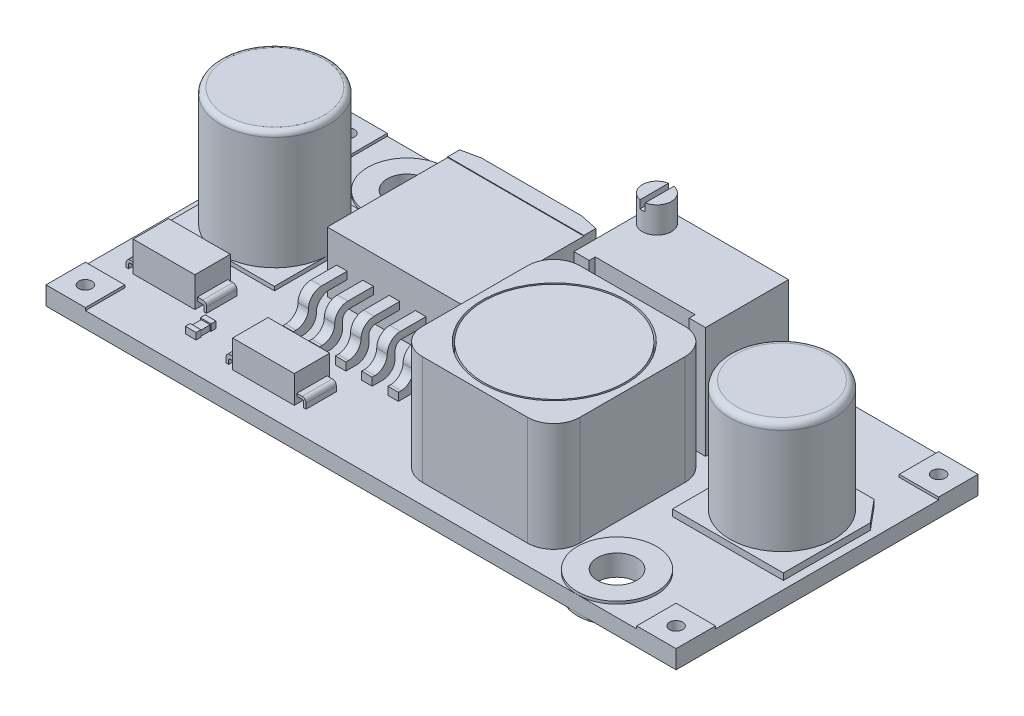
from build123d import *

# Parameters (mm, degrees)
SKETCH1_W                 = 48
SKETCH1_H                 = 23
BOSS_EXTRUDE1_DEPTH       = 1.2
SKETCH2_W                 = 3
SKETCH2_H                 = 3
BOSS_EXTRUDE2_DEPTH       = 0.2
SKETCH3_R                 = 0.5
CUT_EXTRUDE1_DEPTH        = 2
BOSS_EXTRUDE4_DEPTH       = 0.2
BOSS_EXTRUDE4_DEPTH_BACK  = 1.4
SKETCH6_R                 = 3
SKETCH9_R                 = 1.5
CUT_EXTRUDE2_DEPTH        = 2.2
BOSS_EXTRUDE6_DEPTH       = 0.2
BOSS_EXTRUDE6_DEPTH_BACK  = 1.4
SKETCH10_R                = 3
SKETCH12_R                = 1.5
CUT_EXTRUDE4_DEPTH        = 2.2
BOSS_EXTRUDE7_DEPTH       = 1.5
SKETCH14_R                = 4.114223408
BOSS_EXTRUDE8_DEPTH       = 9
FILLET3_R                 = 0.4
SKETCH15_W                = 0.8
SKETCH15_H                = 0.996026271
BOSS_EXTRUDE10_DEPTH      = 0.1
BOSS_EXTRUDE11_DEPTH      = 1.3
SKETCH17_W                = 4.7
SKETCH17_H                = 2.7
BOSS_EXTRUDE12_DEPTH      = 3.5
SKETCH19_W                = 2.321344566
SKETCH19_H                = 0.634066474
BOSS_EXTRUDE14_DEPTH      = 0.7
FILLET4_R                 = 0.3
SKETCH22_W                = 0.50832048
SKETCH22_H                = 0.425111189
CUT_EXTRUDE5_DEPTH        = 2.7
FILLET7_R                 = 0.1
SKETCH23_W                = 2.3
SKETCH23_H                = 0.729977936
BOSS_EXTRUDE15_DEPTH      = 0.7
FILLET8_R                 = 0.3
SKETCH30_W                = 0.503123542
SKETCH30_H                = 0.447939362
CUT_EXTRUDE6_DEPTH        = 2.7
FILLET9_R                 = 0.1
SKETCH31_W                = 11
SKETCH31_H                = 10
BOSS_EXTRUDE16_DEPTH      = 0.1
SKETCH32_W                = 10.374986353
SKETCH32_H                = 9.166939997
BOSS_EXTRUDE17_DEPTH      = 4.6
SKETCH33_W                = 0.8
SKETCH33_H                = 2.544252459
BOSS_EXTRUDE19_DEPTH      = 4.1
SKETCH37_W                = 2.34763847
SKETCH37_H                = 1.983330998
CUT_EXTRUDE10_DEPTH       = 10.1
SKETCH38_W                = 1.15236153
SKETCH38_H                = 1.944252459
CUT_EXTRUDE11_DEPTH       = 10.1
FILLET15_R                = 1
FILLET16_R                = 1
FILLET17_START            = -7.984544591
FILLET17_DEPTH            = 0.8
CUT_EXTRUDE12_DEPTH       = 10.1
FILLET18_R                = 1
FILLET19_R                = 1
FILLET20_R                = 1
FILLET21_R                = 1
FILLET23_R                = 0.5
FILLET24_R                = 0.5
FILLET25_R                = 0.5
FILLET26_R                = 0.5
FILLET28_START            = -5.984544591
FILLET28_DEPTH            = 0.8
FILLET29_START            = -3.984544591
FILLET29_DEPTH            = 0.8
FILLET30_START            = -1.984544591
FILLET30_DEPTH            = 0.8
FILLET31_START            = 0.015455409
FILLET31_DEPTH            = 0.8
SKETCH41_W                = 4.7
SKETCH41_H                = 2.7
BOSS_EXTRUDE20_DEPTH      = 2.1
BOSS_EXTRUDE21_DEPTH      = 0.7
BOSS_EXTRUDE21_DEPTH_BACK = 5.4
SKETCH44_W                = 2.3
SKETCH44_H                = 0.7
SKETCH48_W                = 0.482952196
SKETCH48_H                = 0.4
CUT_EXTRUDE13_DEPTH       = 2.7
SKETCH50_W                = 0.5
SKETCH50_H                = 0.5
CUT_EXTRUDE14_DEPTH       = 2.7
FILLET33_R                = 0.3
FILLET34_R                = 0.1
FILLET35_R                = 0.3
FILLET36_R                = 0.1
BOSS_EXTRUDE22_DEPTH      = 4.65
SKETCH52_W                = 12
SKETCH52_H                = 12
BOSS_EXTRUDE23_DEPTH      = 9.5
SKETCH53_R                = 5.5
CUT_EXTRUDE15_DEPTH       = 8.5
SKETCH54_R                = 5.373077755
BOSS_EXTRUDE24_DEPTH      = 8.5
FILLET38_R                = 2
FILLET39_R                = 2
FILLET40_R                = 2
FILLET41_R                = 2
BOSS_EXTRUDE25_DEPTH      = 8.5
SKETCH56_R                = 1.108072724
BOSS_EXTRUDE26_DEPTH      = 2
CUT_EXTRUDE18_DEPTH       = 0.6
BOSS_EXTRUDE27_DEPTH      = 0.5
SKETCH60_R                = 3.971206554
BOSS_EXTRUDE28_DEPTH      = 8.5
FILLET42_R                = 0.5
SKETCH61_W                = 0.812548187
SKETCH61_H                = 0.377254516
SKETCH61_W_2              = 0.678235166
SKETCH61_H_2              = 0.768684228
BOSS_EXTRUDE30_DEPTH      = 0.5
SKETCH62_W                = 0.678235166
SKETCH62_H                = 0.768684228
CUT_EXTRUDE19_DEPTH       = 0.1
SKETCH63_W                = 0.4
SKETCH63_H                = 0.768429278
SKETCH63_W_2              = 0.756649139
SKETCH63_H_2              = 0.669042342
BOSS_EXTRUDE31_DEPTH      = 0.5
SKETCH64_W                = 0.756649139
SKETCH64_H                = 0.669042342
CUT_EXTRUDE20_DEPTH       = 0.1
SKETCH66_W                = 0.386927708
SKETCH66_H                = 0.773855416
SKETCH66_W_2              = 0.813972447
SKETCH66_H_2              = 0.673855416
BOSS_EXTRUDE32_DEPTH      = 0.5
SKETCH67_W                = 0.813972447
SKETCH67_H                = 0.673855416
CUT_EXTRUDE21_DEPTH       = 0.1


with BuildPart() as part:
    # Sketch1 → Boss-Extrude1 (new body)
    with BuildSketch(Plane(origin=(0, 0, 0), x_dir=(1, 0, 0), z_dir=(0, 1, 0))):
        with Locations((3.904076739, -3.778177458)):
            Rectangle(SKETCH1_W, SKETCH1_H)
    extrude(amount=BOSS_EXTRUDE1_DEPTH)

    # Sketch2 → Boss-Extrude2 (add)
    with BuildSketch(Plane(origin=(0, 1.2, 0), x_dir=(1, 0, 0), z_dir=(0, 1, 0))):
        with Locations((26.404076739, 6.221822542)):
            Rectangle(SKETCH2_W, SKETCH2_H)
        with Locations((-18.595923261, 6.221822542)):
            Rectangle(SKETCH2_W, SKETCH2_H)
        with Locations((26.404076739, -13.778177458)):
            Rectangle(SKETCH2_W, SKETCH2_H)
        with Locations((-18.595923261, -13.778177458)):
            Rectangle(SKETCH2_W, SKETCH2_H)
    extrude(amount=BOSS_EXTRUDE2_DEPTH)

    # Sketch3 → Cut-Extrude1 (cut)
    with BuildSketch(Plane(origin=(0, 1.4, 0), x_dir=(1, 0, 0), z_dir=(0, 1, 0))):
        with Locations(Location((-18.595923261, 6.221822542, 0), (0, 0, 270))):
            Circle(SKETCH3_R)
        with Locations(Location((26.404076739, 6.221822542, 0), (0, 0, 270))):
            Circle(SKETCH3_R)
        with Locations(Location((26.404076739, -13.778177458, 0), (0, 0, 270))):
            Circle(SKETCH3_R)
        with Locations(Location((-18.595923261, -13.778177458, 0), (0, 0, 270))):
            Circle(SKETCH3_R)
    extrude(amount=-CUT_EXTRUDE1_DEPTH, mode=Mode.SUBTRACT)

    # Sketch6 → Boss-Extrude4 (add, two sides: drawn at the far end of the back side and taken through both)
    with BuildSketch(Plane(origin=(0, 1.2, 0), x_dir=(1, 0, 0), z_dir=(0, 1, 0)).offset(-BOSS_EXTRUDE4_DEPTH_BACK)):
        with Locations(Location((-12.595923261, 4.721822542, 0), (0, 0, 270))):
            Circle(SKETCH6_R)
    extrude(amount=BOSS_EXTRUDE4_DEPTH + BOSS_EXTRUDE4_DEPTH_BACK)

    # Sketch9 → Cut-Extrude2 (cut)
    with BuildSketch(Plane(origin=(0, 1.4, 0), x_dir=(1, 0, 0), z_dir=(0, 1, 0))):
        with Locations(Location((-12.595923261, 4.721822542, 0), (0, 0, 270))):
            Circle(SKETCH9_R)
    extrude(amount=-CUT_EXTRUDE2_DEPTH, mode=Mode.SUBTRACT)

    # Sketch10 → Boss-Extrude6 (add, two sides: drawn at the far end of the back side and taken through both)
    with BuildSketch(Plane(origin=(0, 1.2, 0), x_dir=(1, 0, 0), z_dir=(0, 1, 0)).offset(-BOSS_EXTRUDE6_DEPTH_BACK)):
        with Locations(Location((20.404076739, -12.278177458, 0), (0, 0, 270))):
            Circle(SKETCH10_R)
    extrude(amount=BOSS_EXTRUDE6_DEPTH + BOSS_EXTRUDE6_DEPTH_BACK)

    # Sketch12 → Cut-Extrude4 (cut)
    with BuildSketch(Plane(origin=(0, 1.4, 0), x_dir=(1, 0, 0), z_dir=(0, 1, 0))):
        with Locations(Location((20.404076739, -12.278177458, 0), (0, 0, 270))):
            Circle(SKETCH12_R)
    extrude(amount=-CUT_EXTRUDE4_DEPTH, mode=Mode.SUBTRACT)

    # Sketch13 → Boss-Extrude7 (add)
    with BuildSketch(Plane(origin=(0, 0, 0), x_dir=(1, 0, 0), z_dir=(0, 1, 0))):
        Polygon((-18.219111741, 1.521822542), (-12.401181598, 1.521822542), (-11.195923261, -0.318653576), (-11.195923261, -6.778177458), (-19.495923261, -6.778177458), (-19.495923261, -0.318653576), align=None)
    extrude(amount=BOSS_EXTRUDE7_DEPTH)

    # Sketch14 → Boss-Extrude8 (add)
    with BuildSketch(Plane(origin=(0, 1.5, 0), x_dir=(1, 0, 0), z_dir=(0, 1, 0))):
        with Locations((-15.31014667, -2.628177458)):
            Circle(SKETCH14_R)
    extrude(amount=BOSS_EXTRUDE8_DEPTH)

    # Fillet3
    fillet3_edges = [part.edges().sort_by_distance(p)[0] for p in [
        (-19.424370078, 10.5, 2.628177458),
    ]]
    fillet(fillet3_edges, radius=FILLET3_R)

    # Sketch15 → Boss-Extrude10 (add)
    with BuildSketch(Plane(origin=(0, 1.2, 0), x_dir=(1, 0, 0), z_dir=(0, 1, 0))):
        with Locations((-15.544774873, 2.019835678)):
            Rectangle(SKETCH15_W, SKETCH15_H)
    extrude(amount=BOSS_EXTRUDE10_DEPTH)

    # Sketch16 → Boss-Extrude11 (add)
    with BuildSketch(Plane(origin=(0, 0, 0), x_dir=(1, 0, 0), z_dir=(0, 1, 0))):
        Polygon((-15.944774873, -6.778177458), (-15.944774873, -7.863228993), (-15.161070215, -7.863228993), (-15.159186231, -6.778177458), align=None)
    extrude(amount=BOSS_EXTRUDE11_DEPTH)

    # Sketch17 → Boss-Extrude12 (add)
    with BuildSketch(Plane(origin=(0, 0, 0), x_dir=(1, 0, 0), z_dir=(0, 1, 0))):
        with Locations((-15.344373349, -9.6906619)):
            Rectangle(SKETCH17_W, SKETCH17_H)
    extrude(amount=BOSS_EXTRUDE12_DEPTH)

    # Sketch19 → Boss-Extrude14 (add)
    with BuildSketch(Plane.ZY.offset(17.694373349)):
        with Locations((9.712086064, 1.517033237)):
            Rectangle(SKETCH19_W, SKETCH19_H)
    extrude(amount=BOSS_EXTRUDE14_DEPTH)

    # Fillet4
    fillet4_edges = [part.edges().sort_by_distance(p)[0] for p in [
        (-18.394373349, 1.834066474, 9.712086064),
    ]]
    fillet(fillet4_edges, radius=FILLET4_R)

    # Sketch22 → Cut-Extrude5 (cut)
    with BuildSketch(Plane.XY.offset(10.872758347)):
        with Locations((-17.948533589, 1.412555595)):
            Rectangle(SKETCH22_W, SKETCH22_H)
    extrude(amount=-CUT_EXTRUDE5_DEPTH, mode=Mode.SUBTRACT)

    # Fillet7
    fillet7_edges = [part.edges().sort_by_distance(p)[0] for p in [
        (-18.202693829, 1.625111189, 9.712086064),
    ]]
    fillet(fillet7_edges, radius=FILLET7_R)

    # Sketch23 → Boss-Extrude15 (add)
    with BuildSketch(Plane(origin=(-12.994373349, 0, 0), x_dir=(0, 0, -1), z_dir=(1, 0, 0))):
        with Locations((-9.6906619, 1.564988968)):
            Rectangle(SKETCH23_W, SKETCH23_H)
    extrude(amount=BOSS_EXTRUDE15_DEPTH)

    # Fillet8
    fillet8_edges = [part.edges().sort_by_distance(p)[0] for p in [
        (-12.294373349, 1.929977936, 9.6906619),
    ]]
    fillet(fillet8_edges, radius=FILLET8_R)

    # Sketch30 → Cut-Extrude6 (cut)
    with BuildSketch(Plane.XY.offset(10.8406619)):
        with Locations((-12.742811578, 1.423969681)):
            Rectangle(SKETCH30_W, SKETCH30_H)
    extrude(amount=-CUT_EXTRUDE6_DEPTH, mode=Mode.SUBTRACT)

    # Fillet9
    fillet9_edges = [part.edges().sort_by_distance(p)[0] for p in [
        (-12.491249807, 1.647939362, 9.6906619),
    ]]
    fillet(fillet9_edges, radius=FILLET9_R)

    # Sketch31 → Boss-Extrude16 (add)
    with BuildSketch(Plane(origin=(0, 1.2, 0), x_dir=(1, 0, 0), z_dir=(0, 1, 0))):
        with Locations((-3.495923261, 0.921822542)):
            Rectangle(SKETCH31_W, SKETCH31_H)
    extrude(amount=BOSS_EXTRUDE16_DEPTH)

    # Sketch32 → Boss-Extrude17 (add)
    with BuildSketch(Plane(origin=(0, 1.3, 0), x_dir=(1, 0, 0), z_dir=(0, 1, 0))):
        with Locations((-3.508430085, -0.661647456)):
            Rectangle(SKETCH32_W, SKETCH32_H)
    extrude(amount=BOSS_EXTRUDE17_DEPTH)

    # Sketch33 → Boss-Extrude19 (add)
    with BuildSketch(Plane.XY.offset(5.245117455)):
        with Locations((-7.584544591, 2.47212623)):
            Rectangle(SKETCH33_W, SKETCH33_H)
        with Locations((-5.584544591, 2.47212623)):
            Rectangle(SKETCH33_W, SKETCH33_H)
        with Locations((-3.584544591, 2.47212623)):
            Rectangle(SKETCH33_W, SKETCH33_H)
        with Locations((-1.584544591, 2.47212623)):
            Rectangle(SKETCH33_W, SKETCH33_H)
        with Locations((0.415455409, 2.47212623)):
            Rectangle(SKETCH33_W, SKETCH33_H)
    extrude(amount=BOSS_EXTRUDE19_DEPTH)

    # Sketch37 → Cut-Extrude10 (cut)
    with BuildSketch(Plane.ZY.offset(7.984544591)):
        with Locations((6.41893669, 2.191665499)):
            Rectangle(SKETCH37_W, SKETCH37_H)
    extrude(amount=-CUT_EXTRUDE10_DEPTH, mode=Mode.SUBTRACT)

    # Sketch38 → Cut-Extrude11 (cut)
    with BuildSketch(Plane.ZY.offset(7.984544591)):
        with Locations((8.76893669, 2.772126229)):
            Rectangle(SKETCH38_W, SKETCH38_H)
    extrude(amount=-CUT_EXTRUDE11_DEPTH, mode=Mode.SUBTRACT)

    # Fillet15
    fillet15_edges = [part.edges().sort_by_distance(p)[0] for p in [
        (-7.584544591, 3.183330998, 7.592755925),
    ]]
    fillet(fillet15_edges, radius=FILLET15_R)

    # Fillet16
    fillet16_edges = [part.edges().sort_by_distance(p)[0] for p in [
        (-7.584544591, 3.744252459, 8.192755925),
    ]]
    fillet(fillet16_edges, radius=FILLET16_R)

    # Fillet17: read off the stored shape, not the designer's step
    # Fillet17 outline → Fillet17 (add)
    with BuildSketch(Plane.YZ.offset(FILLET17_START)):
        with BuildLine():
            ThreePointArc((3.744252459, 7.192755925), (3.45135924, 7.899862706), (2.744252459, 8.192755925))
            add(Edge.make_bspline(
                [(2.744252459, 8.192755925), (1.8, 8.19848608), (1.8, 9.142755925)],
                knots=[0.004272634, 0.004272634, 0.004272634, 1, 1, 1], degree=2, weights=[0.997507843, 0.708358207, 1]))
            Line((1.8, 9.142755925), (1.8, 9.345117455))
            Line((1.8, 9.345117455), (1.2, 9.345117455))
            Line((1.2, 9.345117455), (1.2, 7.592755925))
            Line((1.2, 7.592755925), (2.183330998, 7.592755925))
            ThreePointArc((2.183330998, 7.592755925), (2.890437779, 7.299862706), (3.183330998, 6.592755925))
            Line((3.183330998, 6.592755925), (3.183330998, 5.245117455))
            Line((3.183330998, 5.245117455), (3.744252459, 5.245117455))
            Line((3.744252459, 5.245117455), (3.744252459, 7.192755925))
        make_face()
    extrude(amount=FILLET17_DEPTH)

    # Sketch39 → Cut-Extrude12 (cut)
    with BuildSketch(Plane.ZY.offset(7.984544591)):
        with BuildLine():
            Line((7.592755925, 2.132341475), (7.592755925, 1.2))
            Line((7.592755925, 1.2), (8.5250974, 1.2))
            ThreePointArc((8.5250974, 1.2), (7.873059786, 1.480303861), (7.592755925, 2.132341475))
        make_face()
    extrude(amount=-CUT_EXTRUDE12_DEPTH, mode=Mode.SUBTRACT)

    # Fillet18
    fillet18_edges = [part.edges().sort_by_distance(p)[0] for p in [
        (-5.584544591, 3.744252459, 8.192755925),
    ]]
    fillet(fillet18_edges, radius=FILLET18_R)

    # Fillet19
    fillet19_edges = [part.edges().sort_by_distance(p)[0] for p in [
        (0.415455409, 3.744252459, 8.192755925),
    ]]
    fillet(fillet19_edges, radius=FILLET19_R)

    # Fillet20
    fillet20_edges = [part.edges().sort_by_distance(p)[0] for p in [
        (-3.584544591, 3.744252459, 8.192755925),
    ]]
    fillet(fillet20_edges, radius=FILLET20_R)

    # Fillet21
    fillet21_edges = [part.edges().sort_by_distance(p)[0] for p in [
        (-1.584544591, 3.744252459, 8.192755925),
    ]]
    fillet(fillet21_edges, radius=FILLET21_R)

    # Fillet23
    fillet23_edges = [part.edges().sort_by_distance(p)[0] for p in [
        (0.415455409, 3.183330998, 7.592755925),
    ]]
    fillet(fillet23_edges, radius=FILLET23_R)

    # Fillet24
    fillet24_edges = [part.edges().sort_by_distance(p)[0] for p in [
        (-1.584544591, 3.183330998, 7.592755925),
    ]]
    fillet(fillet24_edges, radius=FILLET24_R)

    # Fillet25
    fillet25_edges = [part.edges().sort_by_distance(p)[0] for p in [
        (-3.584544591, 3.183330998, 7.592755925),
    ]]
    fillet(fillet25_edges, radius=FILLET25_R)

    # Fillet26
    fillet26_edges = [part.edges().sort_by_distance(p)[0] for p in [
        (-5.584544591, 3.183330998, 7.592755925),
    ]]
    fillet(fillet26_edges, radius=FILLET26_R)

    # Fillet28: read off the stored shape, not the designer's step
    # Fillet28 outline → Fillet28 (add)
    with BuildSketch(Plane.YZ.offset(FILLET28_START)):
        with BuildLine():
            ThreePointArc((3.744252459, 7.192755925), (3.45135924, 7.899862706), (2.744252459, 8.192755925))
            add(Edge.make_bspline(
                [(2.744252459, 8.192755925), (1.8, 8.19848608), (1.8, 9.142755925)],
                knots=[0.004272634, 0.004272634, 0.004272634, 1, 1, 1], degree=2, weights=[0.997507843, 0.708358207, 1]))
            Line((1.8, 9.142755925), (1.8, 9.345117455))
            Line((1.8, 9.345117455), (1.2, 9.345117455))
            Line((1.2, 9.345117455), (1.2, 8.5250974))
            ThreePointArc((1.2, 8.5250974), (1.480303861, 7.873059786), (2.132341475, 7.592755925))
            Line((2.132341475, 7.592755925), (2.683330998, 7.592755925))
            ThreePointArc((2.683330998, 7.592755925), (3.036884389, 7.446309316), (3.183330998, 7.092755925))
            Line((3.183330998, 7.092755925), (3.183330998, 5.245117455))
            Line((3.183330998, 5.245117455), (3.744252459, 5.245117455))
            Line((3.744252459, 5.245117455), (3.744252459, 7.192755925))
        make_face()
    extrude(amount=FILLET28_DEPTH)

    # Fillet29: read off the stored shape, not the designer's step
    # Fillet29 outline → Fillet29 (add)
    with BuildSketch(Plane.YZ.offset(FILLET29_START)):
        with BuildLine():
            ThreePointArc((3.744252459, 7.192755925), (3.45135924, 7.899862706), (2.744252459, 8.192755925))
            add(Edge.make_bspline(
                [(2.744252459, 8.192755925), (1.8, 8.19848608), (1.8, 9.142755925)],
                knots=[0.004272634, 0.004272634, 0.004272634, 1, 1, 1], degree=2, weights=[0.997507843, 0.708358207, 1]))
            Line((1.8, 9.142755925), (1.8, 9.345117455))
            Line((1.8, 9.345117455), (1.2, 9.345117455))
            Line((1.2, 9.345117455), (1.2, 8.5250974))
            ThreePointArc((1.2, 8.5250974), (1.480303861, 7.873059786), (2.132341475, 7.592755925))
            Line((2.132341475, 7.592755925), (2.683330998, 7.592755925))
            ThreePointArc((2.683330998, 7.592755925), (3.036884389, 7.446309316), (3.183330998, 7.092755925))
            Line((3.183330998, 7.092755925), (3.183330998, 5.245117455))
            Line((3.183330998, 5.245117455), (3.744252459, 5.245117455))
            Line((3.744252459, 5.245117455), (3.744252459, 7.192755925))
        make_face()
    extrude(amount=FILLET29_DEPTH)

    # Fillet30: read off the stored shape, not the designer's step
    # Fillet30 outline → Fillet30 (add)
    with BuildSketch(Plane.YZ.offset(FILLET30_START)):
        with BuildLine():
            ThreePointArc((3.744252459, 7.192755925), (3.45135924, 7.899862706), (2.744252459, 8.192755925))
            add(Edge.make_bspline(
                [(2.744252459, 8.192755925), (1.8, 8.19848608), (1.8, 9.142755925)],
                knots=[0.004272634, 0.004272634, 0.004272634, 1, 1, 1], degree=2, weights=[0.997507843, 0.708358207, 1]))
            Line((1.8, 9.142755925), (1.8, 9.345117455))
            Line((1.8, 9.345117455), (1.2, 9.345117455))
            Line((1.2, 9.345117455), (1.2, 8.5250974))
            ThreePointArc((1.2, 8.5250974), (1.480303861, 7.873059786), (2.132341475, 7.592755925))
            Line((2.132341475, 7.592755925), (2.683330998, 7.592755925))
            ThreePointArc((2.683330998, 7.592755925), (3.036884389, 7.446309316), (3.183330998, 7.092755925))
            Line((3.183330998, 7.092755925), (3.183330998, 5.245117455))
            Line((3.183330998, 5.245117455), (3.744252459, 5.245117455))
            Line((3.744252459, 5.245117455), (3.744252459, 7.192755925))
        make_face()
    extrude(amount=FILLET30_DEPTH)

    # Fillet31: read off the stored shape, not the designer's step
    # Fillet31 outline → Fillet31 (add)
    with BuildSketch(Plane.YZ.offset(FILLET31_START)):
        with BuildLine():
            ThreePointArc((3.744252459, 7.192755925), (3.45135924, 7.899862706), (2.744252459, 8.192755925))
            add(Edge.make_bspline(
                [(2.744252459, 8.192755925), (1.8, 8.19848608), (1.8, 9.142755925)],
                knots=[0.004272634, 0.004272634, 0.004272634, 1, 1, 1], degree=2, weights=[0.997507843, 0.708358207, 1]))
            Line((1.8, 9.142755925), (1.8, 9.345117455))
            Line((1.8, 9.345117455), (1.2, 9.345117455))
            Line((1.2, 9.345117455), (1.2, 8.5250974))
            ThreePointArc((1.2, 8.5250974), (1.480303861, 7.873059786), (2.132341475, 7.592755925))
            Line((2.132341475, 7.592755925), (2.683330998, 7.592755925))
            ThreePointArc((2.683330998, 7.592755925), (3.036884389, 7.446309316), (3.183330998, 7.092755925))
            Line((3.183330998, 7.092755925), (3.183330998, 5.245117455))
            Line((3.183330998, 5.245117455), (3.744252459, 5.245117455))
            Line((3.744252459, 5.245117455), (3.744252459, 7.192755925))
        make_face()
    extrude(amount=FILLET31_DEPTH)

    # Sketch41 → Boss-Extrude20 (add)
    with BuildSketch(Plane(origin=(0, 1.2, 0), x_dir=(1, 0, 0), z_dir=(0, 1, 0))):
        with Locations((-5.234850044, -12.22561324)):
            Rectangle(SKETCH41_W, SKETCH41_H)
    extrude(amount=BOSS_EXTRUDE20_DEPTH)

    # Sketch44 → Boss-Extrude21 (add, two sides: drawn at the far end of the back side and taken through both)
    with BuildSketch(Plane(origin=(-2.884850044, 0, 0), x_dir=(0, 0, -1), z_dir=(1, 0, 0)).offset(-BOSS_EXTRUDE21_DEPTH_BACK)):
        with Locations((-12.22561324, 1.55)):
            Rectangle(SKETCH44_W, SKETCH44_H)
    extrude(amount=BOSS_EXTRUDE21_DEPTH + BOSS_EXTRUDE21_DEPTH_BACK)

    # Sketch48 → Cut-Extrude13 (cut)
    with BuildSketch(Plane.XY.offset(13.37561324)):
        with Locations((-7.843373946, 1.4)):
            Rectangle(SKETCH48_W, SKETCH48_H)
    extrude(amount=-CUT_EXTRUDE13_DEPTH, mode=Mode.SUBTRACT)

    # Sketch50 → Cut-Extrude14 (cut)
    with BuildSketch(Plane.XY.offset(13.37561324)):
        with Locations((-2.634850044, 1.45)):
            Rectangle(SKETCH50_W, SKETCH50_H)
    extrude(amount=-CUT_EXTRUDE14_DEPTH, mode=Mode.SUBTRACT)

    # Fillet33
    fillet33_edges = [part.edges().sort_by_distance(p)[0] for p in [
        (-8.284850044, 1.9, 12.22561324),
    ]]
    fillet(fillet33_edges, radius=FILLET33_R)

    # Fillet34
    fillet34_edges = [part.edges().sort_by_distance(p)[0] for p in [
        (-8.084850044, 1.6, 12.22561324),
    ]]
    fillet(fillet34_edges, radius=FILLET34_R)

    # Fillet35
    fillet35_edges = [part.edges().sort_by_distance(p)[0] for p in [
        (-2.184850044, 1.9, 12.22561324),
    ]]
    fillet(fillet35_edges, radius=FILLET35_R)

    # Fillet36
    fillet36_edges = [part.edges().sort_by_distance(p)[0] for p in [
        (-2.384850044, 1.7, 12.22561324),
    ]]
    fillet(fillet36_edges, radius=FILLET36_R)

    # Sketch51 → Boss-Extrude22 (add)
    with BuildSketch(Plane(origin=(0, 1.3, 0), x_dir=(1, 0, 0), z_dir=(0, 1, 0))):
        Polygon((-8.695923261, 3.921822542), (-8.695923261, 4.837831857), (-7.326257439, 5.127686189), (0.309397269, 5.127686189), (1.679063092, 4.837831857), (1.679063092, 3.921822542), align=None)
    extrude(amount=BOSS_EXTRUDE22_DEPTH)

    # Sketch52 → Boss-Extrude23 (add)
    with BuildSketch(Plane(origin=(0, 0, 0), x_dir=(1, 0, 0), z_dir=(0, 1, 0))):
        with Locations((11.079063092, -7.778177458)):
            Rectangle(SKETCH52_W, SKETCH52_H)
    extrude(amount=BOSS_EXTRUDE23_DEPTH)

    # Sketch53 → Cut-Extrude15 (cut)
    with BuildSketch(Plane(origin=(0, 9.5, 0), x_dir=(1, 0, 0), z_dir=(0, 1, 0))):
        with Locations(Location((11.122481252, -7.778177458, 0), (0, 0, 270))):
            Circle(SKETCH53_R)
    extrude(amount=-CUT_EXTRUDE15_DEPTH, mode=Mode.SUBTRACT)

    # Sketch54 → Boss-Extrude24 (add)
    with BuildSketch(Plane(origin=(0, 1, 0), x_dir=(1, 0, 0), z_dir=(0, 1, 0))):
        with Locations(Location((11.122481252, -7.778177458, 0), (0, 0, 270))):
            Circle(SKETCH54_R)
    extrude(amount=BOSS_EXTRUDE24_DEPTH)

    # Fillet38
    fillet38_edges = [part.edges().sort_by_distance(p)[0] for p in [
        (5.079063092, 5.35, 13.778177458),
    ]]
    fillet(fillet38_edges, radius=FILLET38_R)

    # Fillet39
    fillet39_edges = [part.edges().sort_by_distance(p)[0] for p in [
        (17.079063092, 5.35, 13.778177458),
    ]]
    fillet(fillet39_edges, radius=FILLET39_R)

    # Fillet40
    fillet40_edges = [part.edges().sort_by_distance(p)[0] for p in [
        (17.079063092, 5.35, 1.778177458),
    ]]
    fillet(fillet40_edges, radius=FILLET40_R)

    # Fillet41
    fillet41_edges = [part.edges().sort_by_distance(p)[0] for p in [
        (5.079063092, 5.35, 1.778177458),
    ]]
    fillet(fillet41_edges, radius=FILLET41_R)

    # Sketch55 → Boss-Extrude25 (add)
    with BuildSketch(Plane(origin=(0, 1.2, 0), x_dir=(1, 0, 0), z_dir=(0, 1, 0))):
        Polygon((6.114973238, 5.050662275), (16.144809948, 5.050662275), (16.144809948, -1.273371313), (14.896115418, -1.273371313), (14.896115418, -0.815559673), (7.283106831, -0.815559673), (7.283106831, -1.273371313), (6.114973238, -1.273371313), align=None)
    extrude(amount=BOSS_EXTRUDE25_DEPTH)

    # Sketch56 → Boss-Extrude26 (add)
    with BuildSketch(Plane(origin=(0, 9.7, 0), x_dir=(1, 0, 0), z_dir=(0, 1, 0))):
        with Locations(Location((7.414973238, 3.750662275, 0), (0, 0, 270))):
            Circle(SKETCH56_R)
    extrude(amount=BOSS_EXTRUDE26_DEPTH)

    # Sketch57 → Cut-Extrude18 (cut)
    with BuildSketch(Plane(origin=(0, 11.7, 0), x_dir=(1, 0, 0), z_dir=(0, 1, 0))):
        with BuildLine():
            Line((7.214973238, 4.840536195), (7.214973238, 2.660788355))
            ThreePointArc((7.214973238, 2.660788355), (7.414973238, 2.624033642), (7.614973238, 2.660788355))
            Line((7.614973238, 2.660788355), (7.614973238, 4.840536195))
            ThreePointArc((7.614973238, 4.840536195), (7.414973238, 4.8742972), (7.214973238, 4.840536195))
        make_face()
    extrude(amount=-CUT_EXTRUDE18_DEPTH, mode=Mode.SUBTRACT)

    # Sketch59 → Boss-Extrude27 (add)
    with BuildSketch(Plane(origin=(0, 1.2, 0), x_dir=(1, 0, 0), z_dir=(0, 1, 0))):
        Polygon((18.851263116, 0), (18.851263116, -6.5), (27.297642189, -6.5), (27.297642189, 0.127224639), (25.890108667, 1.818037871), (20.090108667, 1.818037871), align=None)
    extrude(amount=BOSS_EXTRUDE27_DEPTH)

    # Sketch60 → Boss-Extrude28 (add)
    with BuildSketch(Plane(origin=(0, 1.7, 0), x_dir=(1, 0, 0), z_dir=(0, 1, 0))):
        with Locations(Location((23.03228066, -2.340981064, 0), (0, 0, 270))):
            Circle(SKETCH60_R)
    extrude(amount=BOSS_EXTRUDE28_DEPTH)

    # Fillet42
    fillet42_edges = [part.edges().sort_by_distance(p)[0] for p in [
        (23.03228066, 10.2, -1.63022549),
    ]]
    fillet(fillet42_edges, radius=FILLET42_R)

    # Sketch61 → Boss-Extrude30 (add)
    with BuildSketch(Plane(origin=(0, 1.2, 0), x_dir=(1, 0, 0), z_dir=(0, 1, 0))):
        with Locations((-11.345014696, -11.676743699)):
            Rectangle(SKETCH61_W, SKETCH61_H)
        with Locations((-11.345328694, -12.249713071)):
            Rectangle(SKETCH61_W_2, SKETCH61_H_2)
        Polygon((-11.006211111, -12.634055185), (-11.684446277, -12.634055185), (-11.751288789, -12.634055185), (-11.751288789, -13.003655248), (-10.938740602, -13.003655248), (-10.938740602, -12.634055185), align=None)
    extrude(amount=BOSS_EXTRUDE30_DEPTH)

    # Sketch62 → Cut-Extrude19 (cut)
    with BuildSketch(Plane(origin=(0, 1.7, 0), x_dir=(1, 0, 0), z_dir=(0, 1, 0))):
        with Locations((-11.345328694, -12.249713071)):
            Rectangle(SKETCH62_W, SKETCH62_H)
    extrude(amount=-CUT_EXTRUDE19_DEPTH, mode=Mode.SUBTRACT)

    # Sketch63 → Boss-Extrude31 (add)
    with BuildSketch(Plane(origin=(0, 1.2, 0), x_dir=(1, 0, 0), z_dir=(0, 1, 0))):
        with Locations((7.655372813, 6.203355861)):
            Rectangle(SKETCH63_W, SKETCH63_H)
        with Locations((8.233697383, 6.203546919)):
            Rectangle(SKETCH63_W_2, SKETCH63_H_2)
        Polygon((8.612021952, 6.5875705), (8.612021952, 6.53806809), (8.612021952, 5.869025748), (8.612021952, 5.819141222), (9.012021952, 5.819141222), (9.012021952, 6.5875705), align=None)
    extrude(amount=BOSS_EXTRUDE31_DEPTH)

    # Sketch64 → Cut-Extrude20 (cut)
    with BuildSketch(Plane(origin=(0, 1.7, 0), x_dir=(1, 0, 0), z_dir=(0, 1, 0))):
        with Locations((8.233697383, 6.203546919)):
            Rectangle(SKETCH64_W, SKETCH64_H)
    extrude(amount=-CUT_EXTRUDE20_DEPTH, mode=Mode.SUBTRACT)

    # Sketch66 → Boss-Extrude32 (add)
    with BuildSketch(Plane(origin=(0, 1.2, 0), x_dir=(1, 0, 0), z_dir=(0, 1, 0))):
        with Locations((10.083250281, 6.195831807)):
            Rectangle(SKETCH66_W, SKETCH66_H)
        with Locations((10.683700359, 6.195831807)):
            Rectangle(SKETCH66_W_2, SKETCH66_H_2)
        Polygon((11.090686582, 6.582759515), (11.090686582, 6.532759515), (11.090686582, 5.858904099), (11.090686582, 5.808904099), (11.469011705, 5.808904099), (11.469011705, 6.582759515), align=None)
    extrude(amount=BOSS_EXTRUDE32_DEPTH)

    # Sketch67 → Cut-Extrude21 (cut)
    with BuildSketch(Plane(origin=(0, 1.7, 0), x_dir=(1, 0, 0), z_dir=(0, 1, 0))):
        with Locations((10.683700359, 6.195831807)):
            Rectangle(SKETCH67_W, SKETCH67_H)
    extrude(amount=-CUT_EXTRUDE21_DEPTH, mode=Mode.SUBTRACT)


solid = part.part
